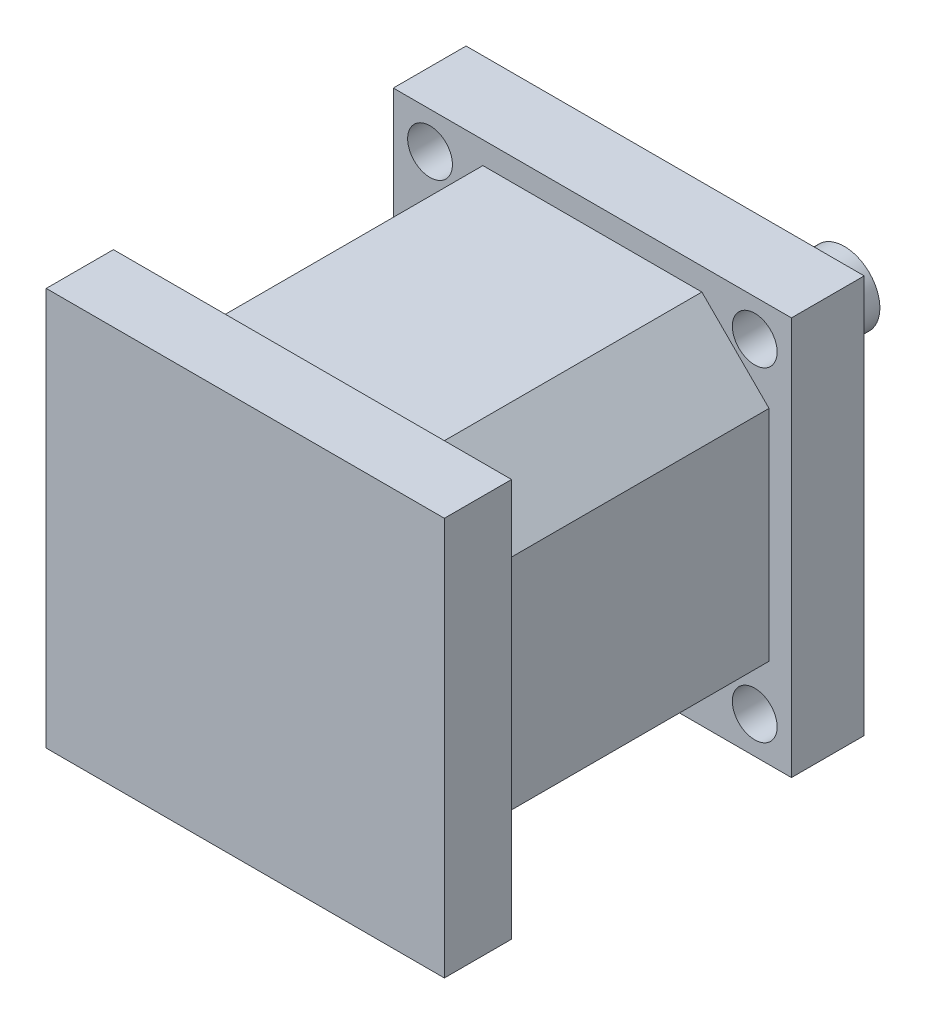
from build123d import *

# Parameters (mm, degrees)
SKETCH1_W           = 35.56
SKETCH1_H           = 35.56
BOSS_EXTRUDE1_DEPTH = 4.5
SKETCH2_W           = 35.56
SKETCH2_H           = 35.56
BOSS_EXTRUDE2_DEPTH = 2
SKETCH5_R           = 11
BOSS_EXTRUDE5_DEPTH = 2
SKETCH6_R           = 3.175
BOSS_EXTRUDE6_DEPTH = 24
SKETCH7_R           = 2
CUT_EXTRUDE3_DEPTH  = 29
SKETCH8_W           = 31.56
SKETCH8_H           = 31.56
BOSS_EXTRUDE7_DEPTH = 25
SKETCH9_W           = 35.56
SKETCH9_H           = 35.56
BOSS_EXTRUDE8_DEPTH = 6
CHAMFER1_SIZE       = 6
SCALE1_SCALE        = 0.85
CUT_EXTRUDE4_START  = -8.5
SKETCH10_R          = 2.69875
CUT_EXTRUDE4_DEPTH  = 8.5


with BuildPart() as part:
    # Sketch1 → Boss-Extrude1 (new body)
    with BuildSketch(Plane.XY):
        with Locations((21.15, 20.624391857)):
            Rectangle(SKETCH1_W, SKETCH1_H)
    extrude(amount=BOSS_EXTRUDE1_DEPTH)

    # Sketch2 → Boss-Extrude2 (add)
    with BuildSketch(Plane.XY.offset(4.5)):
        with Locations((21.15, 20.624391857)):
            Rectangle(SKETCH2_W, SKETCH2_H)
    extrude(amount=BOSS_EXTRUDE2_DEPTH)

    # Sketch5 → Boss-Extrude5 (add)
    with BuildSketch(Plane(origin=(0, 0, 0), x_dir=(-1, 0, 0), z_dir=(0, 0, -1))):
        with Locations((-21.15, 20.624391857)):
            Circle(SKETCH5_R)
    extrude(amount=BOSS_EXTRUDE5_DEPTH)

    # Sketch6 → Boss-Extrude6 (add)
    with BuildSketch(Plane(origin=(0, 0, -2), x_dir=(-1, 0, 0), z_dir=(0, 0, -1))):
        with Locations((-21.15, 20.624391857)):
            Circle(SKETCH6_R)
    extrude(amount=BOSS_EXTRUDE6_DEPTH)

    # Sketch7 → Cut-Extrude3 (cut)
    with BuildSketch(Plane(origin=(0, 0, 0), x_dir=(-1, 0, 0), z_dir=(0, 0, -1))):
        with Locations((-35.65, 6.124391857)):
            Circle(SKETCH7_R)
        with Locations((-6.65, 6.124391857)):
            Circle(SKETCH7_R)
        with Locations((-6.65, 35.124391857)):
            Circle(SKETCH7_R)
        with Locations((-35.65, 35.124391857)):
            Circle(SKETCH7_R)
    extrude(amount=-CUT_EXTRUDE3_DEPTH, mode=Mode.SUBTRACT)

    # Sketch8 → Boss-Extrude7 (add)
    with BuildSketch(Plane.XY.offset(6.5)):
        with Locations((21.15, 20.624391857)):
            Rectangle(SKETCH8_W, SKETCH8_H)
    extrude(amount=BOSS_EXTRUDE7_DEPTH)

    # Sketch9 → Boss-Extrude8 (add)
    with BuildSketch(Plane.XY.offset(31.5)):
        with Locations((21.15, 20.624391857)):
            Rectangle(SKETCH9_W, SKETCH9_H)
    extrude(amount=BOSS_EXTRUDE8_DEPTH)

    # Chamfer1
    # the kernel refuses this chamfer: 6 mm, written as the material it takes off along each edge
    with BuildSketch(Plane(origin=(5.37, 36.404391857, 6.5), x_dir=(0.9996219169112968, 0.02749587661058678, 0), z_dir=(0, 0, 1)), Plane(origin=(36.93, 4.844391857, 6.5), x_dir=(-0.9996219169112969, -0.027495876610586355, 0), z_dir=(0, 0, 1)), Plane(origin=(36.93, 36.404391857, 6.5), x_dir=(0.02749587661058678, -0.9996219169112968, 0), z_dir=(0, 0, 1))) as chamfer1_piece_1:
        Polygon((CHAMFER1_SIZE * 0.999621916911, -CHAMFER1_SIZE * 0.0274958766106), (-CHAMFER1_SIZE * 0.0274958766106, -CHAMFER1_SIZE * 0.999621916911), (0, 0), align=None)
    extrude(amount=25, mode=Mode.SUBTRACT)
    with BuildSketch(Plane(origin=(5.37, 4.844391857, 6.5), x_dir=(0.9996219169112969, -0.027495876610586348, 0), z_dir=(0, 0, 1))) as chamfer1_piece_2:
        Polygon((CHAMFER1_SIZE * 0.999621916911, CHAMFER1_SIZE * 0.0274958766106), (-CHAMFER1_SIZE * 0.0274958766106, CHAMFER1_SIZE * 0.999621916911), (0, 0), align=None)
    extrude(amount=25, mode=Mode.SUBTRACT)


with BuildPart() as part_1:
    # Scale1: scaled about (21.15, 20.624391857, 17.82804973)
    add(part.part.scale(SCALE1_SCALE).moved(Location((3.1725, 3.093658779, 2.67420746))))

    # Sketch10 → Cut-Extrude4 (cut)
    with BuildSketch(Plane(origin=(0, 0, -19.425792541), x_dir=(-1, 0, 0), z_dir=(0, 0, -1)).offset(CUT_EXTRUDE4_START)):
        with Locations((-21.15, 20.624391857)):
            Circle(SKETCH10_R)
    extrude(amount=CUT_EXTRUDE4_DEPTH, mode=Mode.SUBTRACT)


solid = part_1.part
